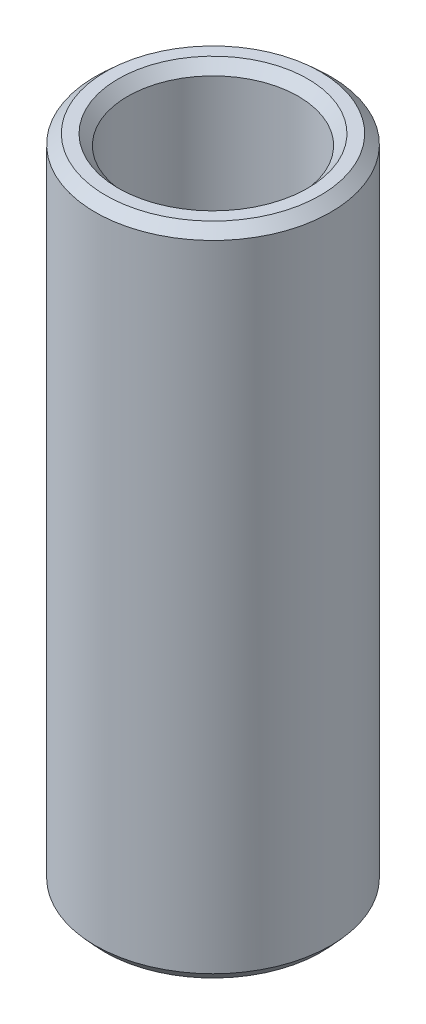
from build123d import *
from OCP.BRepFilletAPI import BRepFilletAPI_MakeChamfer

# Parameters (mm, degrees)
SKETCH1_R           = 37.5
BOSS_EXTRUDE1_DEPTH = 208.726118489
SKETCH2_R           = 27.193196237
CUT_EXTRUDE1_DEPTH  = 216.358056593
CHAMFER1_SIZE       = 3.007607124
CHAMFER1_SIZE2      = 3.309986834


with BuildPart() as part:
    # Sketch1 → Boss-Extrude1 (new body)
    with BuildSketch(Plane(origin=(0, 0, 0), x_dir=(1, 0, 0), z_dir=(0, 1, 0))):
        Circle(SKETCH1_R)
    extrude(amount=BOSS_EXTRUDE1_DEPTH)

    # Sketch2 → Cut-Extrude1 (cut, through all)
    with BuildSketch(Plane(origin=(0, 0, 0), x_dir=(1, 0, 0), z_dir=(0, 1, 0))):
        Circle(SKETCH2_R)
    extrude(amount=CUT_EXTRUDE1_DEPTH, mode=Mode.SUBTRACT)

    # Chamfer1: one chamfer whose edges measure the first distance from different faces: ONE call of the kernel's chamfer builder (chamfer() names one face for all edges)
    chamfer1_edges_1 = [part.edges().sort_by_distance(p)[0] for p in [
        (-27.193196237, 208.726118489, 0),
    ]]
    chamfer1_side_1 = [part.faces().sort_by_distance(p)[0] for p in [
        (-36.439339828, 208.726118489, 0),
    ]]
    chamfer1_edges_2 = [part.edges().sort_by_distance(p)[0] for p in [
        (-27.193196237, 0, 0),
    ]]
    chamfer1_side_2 = [part.faces().sort_by_distance(p)[0] for p in [
        (-27.193196237, 104.363059244, 0),
    ]]
    chamfer1_edges_3 = [part.edges().sort_by_distance(p)[0] for p in [
        (-37.5, 0, 0),
    ]]
    chamfer1_side_3 = [part.faces().sort_by_distance(p)[0] for p in [
        (-36.439339828, 0, 0),
    ]]
    chamfer1_edges_4 = [part.edges().sort_by_distance(p)[0] for p in [
        (-37.5, 208.726118489, 0),
    ]]
    chamfer1_side_4 = [part.faces().sort_by_distance(p)[0] for p in [
        (-37.5, 104.363059244, 0),
    ]]
    chamfer1 = BRepFilletAPI_MakeChamfer(part.part.solid().wrapped)
    for e in chamfer1_edges_1:
        chamfer1.Add(CHAMFER1_SIZE, CHAMFER1_SIZE2, e.wrapped, chamfer1_side_1[0].wrapped)  # the first distance lies on this face
    for e in chamfer1_edges_2:
        chamfer1.Add(CHAMFER1_SIZE, CHAMFER1_SIZE2, e.wrapped, chamfer1_side_2[0].wrapped)  # the first distance lies on this face
    for e in chamfer1_edges_3:
        chamfer1.Add(CHAMFER1_SIZE, CHAMFER1_SIZE2, e.wrapped, chamfer1_side_3[0].wrapped)  # the first distance lies on this face
    for e in chamfer1_edges_4:
        chamfer1.Add(CHAMFER1_SIZE, CHAMFER1_SIZE2, e.wrapped, chamfer1_side_4[0].wrapped)  # the first distance lies on this face
    add(Compound.cast(chamfer1.Shape()), mode=Mode.REPLACE)


solid = part.part
